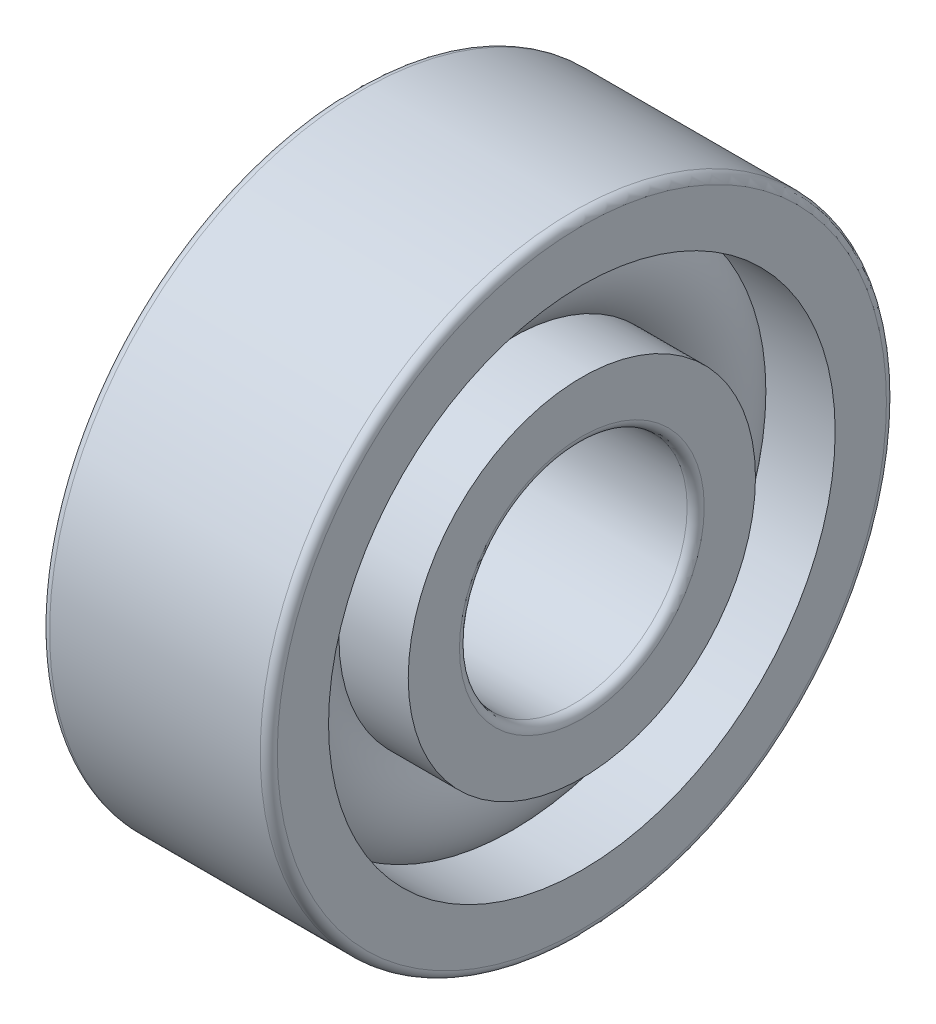
from build123d import *

# Parameters (mm, degrees)
CAGSPISKE_W     = 0.21
CAGSPISKE_H     = 0.35
CAGESPINE_ANGLE = 0.001
BALSIMSKE_R     = 1.05


with BuildPart() as part:
    # CagSpiSke → CageSpine (revolve)
    with BuildSketch(Plane.XY):
        with Locations((0, 3.75)):
            Rectangle(CAGSPISKE_W, CAGSPISKE_H)
    revolve(axis=Axis((-20.6375, 0, 0), (-1, 0, 0)), revolution_arc=CAGESPINE_ANGLE)

    # BalSimSke → BallsSimplified (revolve)
    with BuildSketch(Plane.XY):
        with Locations((0, 3.75)):
            Circle(BALSIMSKE_R)
    revolve(axis=Axis((-10, 0, 0), (1, 0, 0)))

    # InnRacSke → InnerRace (revolve)
    with BuildSketch(Plane.XY):
        with BuildLine():
            Line((-0.748748957, 3.05), (-2, 3.05))
            Line((-2, 3.05), (-2, 2.15))
            ThreePointArc((-2, 2.15), (-1.956066017, 2.043933983), (-1.85, 2))
            Line((-1.85, 2), (1.85, 2))
            ThreePointArc((1.85, 2), (1.956066017, 2.043933983), (2, 2.15))
            Line((2, 2.15), (2, 3.05))
            Line((2, 3.05), (0.748748957, 3.05))
            ThreePointArc((0.748748957, 3.05), (0, 2.725), (-0.748748957, 3.05))
        make_face()
    revolve(axis=Axis((-20.6375, 0, 0), (1, 0, 0)))

    # OutRacSke → OuterRace (revolve)
    with BuildSketch(Plane.XY):
        with BuildLine():
            Line((-0.748748957, 4.45), (-2, 4.45))
            Line((-2, 4.45), (-2, 5.35))
            ThreePointArc((-2, 5.35), (-1.956066017, 5.456066017), (-1.85, 5.5))
            Line((-1.85, 5.5), (1.85, 5.5))
            ThreePointArc((1.85, 5.5), (1.956066017, 5.456066017), (2, 5.35))
            Line((2, 5.35), (2, 4.45))
            Line((2, 4.45), (0.748748957, 4.45))
            ThreePointArc((0.748748957, 4.45), (0, 4.775), (-0.748748957, 4.45))
        make_face()
    revolve(axis=Axis((-20.6375, 0, 0), (1, 0, 0)))


solid = part.part
